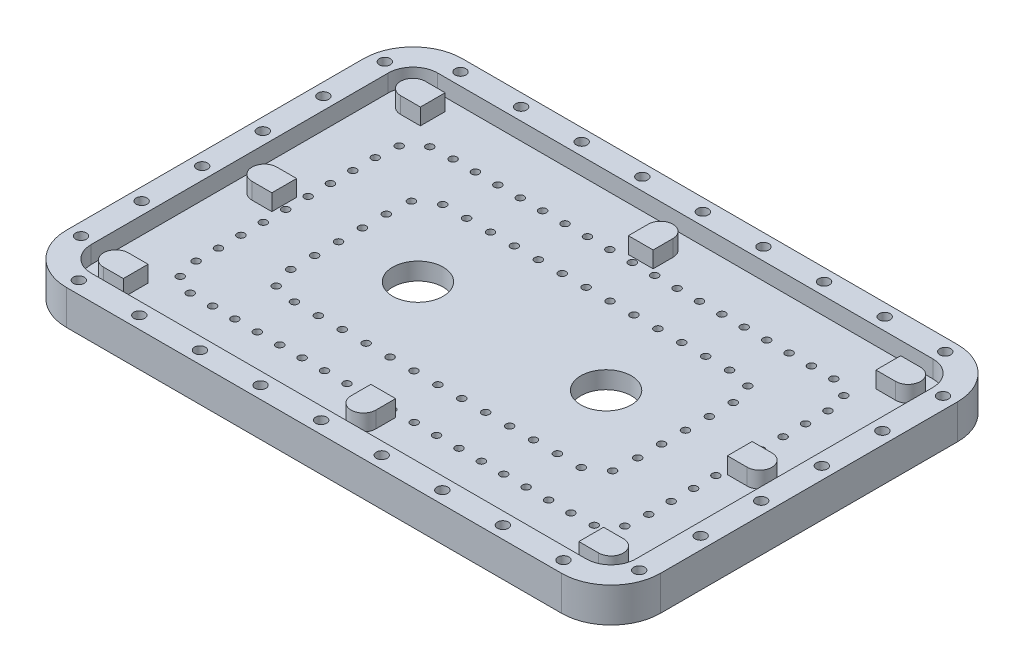
from build123d import *

# Parameters (mm, degrees)
SKETCH1_W                    = 120
SKETCH1_H                    = 80
BOSS_EXTRUDE1_DEPTH          = 7
SKETCH2_W                    = 110
SKETCH2_H                    = 70
CUT_EXTRUDE1_DEPTH           = 3.5
F_10_2_10_2_DIAMETER_HOLE1_D = 10.2
FILLET1_R                    = 10
FILLET3_R                    = 5
F_2_5MM_DOWEL_HOLE1_D        = 2.2
CRVPATTERN1_OUTLINE_R        = 1.1
CRVPATTERN1_DEPTH            = 7
F_1_5MM_DOWEL_HOLE2_D        = 1.5
CRVPATTERN3_OUTLINE_R        = 0.75
CRVPATTERN3_DEPTH            = 3.5
F_1_5MM_DOWEL_HOLE3_D        = 1.5
CRVPATTERN4_OUTLINE_R        = 0.75
CRVPATTERN4_DEPTH            = 3.5
BOSS_EXTRUDE2_DEPTH          = 3.3
SKETCH24_R                   = 2
CUT_EXTRUDE2_DEPTH           = 1.5
CRVPATTERN5_OUTLINE_R        = 2
CRVPATTERN5_OUTLINE_R_2      = 1.1
CRVPATTERN5_DEPTH            = 1.5


# Read off the part's stored shape, not the designer's step: CrvPattern1, CrvPattern3, CrvPattern4, CrvPattern5
with BuildPart() as part:
    # Sketch1 → Boss-Extrude1 (new body)
    with BuildSketch(Plane(origin=(0, 7, 0), x_dir=(1, 0, 0), z_dir=(0, 1, 0))):
        Rectangle(SKETCH1_W, SKETCH1_H)
    extrude(amount=-BOSS_EXTRUDE1_DEPTH)

    # Sketch2 → Cut-Extrude1 (cut)
    with BuildSketch(Plane(origin=(0, 7, 0), x_dir=(-1, 0, 0), z_dir=(0, 1, 0))):
        Rectangle(SKETCH2_W, SKETCH2_H)
    extrude(amount=-CUT_EXTRUDE1_DEPTH, mode=Mode.SUBTRACT)

    # Ø10.2 (10.2) Diameter Hole1 (through all)
    with Locations(Plane(origin=(0, 3.5, 0), x_dir=(1, 0, 0), z_dir=(0, 1, 0))):
        with Locations((19, 0), (-19, 0)):
            Hole(F_10_2_10_2_DIAMETER_HOLE1_D / 2)

    # Fillet1
    fillet1_edges = [part.edges().sort_by_distance(p)[0] for p in [
        (-60, 3.5, -40),
        (60, 3.5, -40),
        (60, 3.5, 40),
        (-60, 3.5, 40),
    ]]
    fillet(fillet1_edges, radius=FILLET1_R)

    # Fillet3
    fillet3_edges = [part.edges().sort_by_distance(p)[0] for p in [
        (-55, 5.25, 35),
        (-55, 5.25, -35),
        (55, 5.25, -35),
        (55, 5.25, 35),
    ]]
    fillet(fillet3_edges, radius=FILLET3_R)

    # Ø2.5mm Dowel Hole1 (through all)
    with Locations(Plane(origin=(0, 7, 0), x_dir=(1, 0, 0), z_dir=(0, 1, 0))):
        with Locations((50, 37.5)):
            Hole(F_2_5MM_DOWEL_HOLE1_D / 2)

    # CrvPattern1 outline → CrvPattern1 (cut)
    with BuildSketch(Plane(origin=(0, 0, 0), x_dir=(1, 0, 0), z_dir=(0, 1, 0))):
        with Locations((37.762537007, 37.5)):
            Circle(CRVPATTERN1_OUTLINE_R)
        with Locations((25.525074013, 37.5)):
            Circle(CRVPATTERN1_OUTLINE_R)
        with Locations((13.28761102, 37.5)):
            Circle(CRVPATTERN1_OUTLINE_R)
        with Locations((1.050148026, 37.5)):
            Circle(CRVPATTERN1_OUTLINE_R)
        with Locations((-11.187314967, 37.5)):
            Circle(CRVPATTERN1_OUTLINE_R)
        with Locations((-23.424777961, 37.5)):
            Circle(CRVPATTERN1_OUTLINE_R)
        with Locations((-35.662240954, 37.5)):
            Circle(CRVPATTERN1_OUTLINE_R)
        with Locations((-47.899703948, 37.5)):
            Circle(CRVPATTERN1_OUTLINE_R)
        with Locations((-57.320580195, 31.630676428)):
            Circle(CRVPATTERN1_OUTLINE_R)
        with Locations((-57.5, 19.406342516)):
            Circle(CRVPATTERN1_OUTLINE_R)
        with Locations((-57.5, 7.168879523)):
            Circle(CRVPATTERN1_OUTLINE_R)
        with Locations((-57.5, -5.068583471)):
            Circle(CRVPATTERN1_OUTLINE_R)
        with Locations((-57.5, -17.306046464)):
            Circle(CRVPATTERN1_OUTLINE_R)
        with Locations((-57.5, -29.543509458)):
            Circle(CRVPATTERN1_OUTLINE_R)
        with Locations((-50, -37.5)):
            Circle(CRVPATTERN1_OUTLINE_R)
        with Locations((-37.762537007, -37.5)):
            Circle(CRVPATTERN1_OUTLINE_R)
        with Locations((-25.525074013, -37.5)):
            Circle(CRVPATTERN1_OUTLINE_R)
        with Locations((-13.28761102, -37.5)):
            Circle(CRVPATTERN1_OUTLINE_R)
        with Locations((-1.050148026, -37.5)):
            Circle(CRVPATTERN1_OUTLINE_R)
        with Locations((11.187314967, -37.5)):
            Circle(CRVPATTERN1_OUTLINE_R)
        with Locations((23.424777961, -37.5)):
            Circle(CRVPATTERN1_OUTLINE_R)
        with Locations((35.662240954, -37.5)):
            Circle(CRVPATTERN1_OUTLINE_R)
        with Locations((47.899703948, -37.5)):
            Circle(CRVPATTERN1_OUTLINE_R)
        with Locations((57.320580195, -31.630676428)):
            Circle(CRVPATTERN1_OUTLINE_R)
        with Locations((57.5, -19.406342516)):
            Circle(CRVPATTERN1_OUTLINE_R)
        with Locations((57.5, -7.168879523)):
            Circle(CRVPATTERN1_OUTLINE_R)
        with Locations((57.5, 5.068583471)):
            Circle(CRVPATTERN1_OUTLINE_R)
        with Locations((57.5, 17.306046464)):
            Circle(CRVPATTERN1_OUTLINE_R)
        with Locations((57.5, 29.543509458)):
            Circle(CRVPATTERN1_OUTLINE_R)
    extrude(amount=CRVPATTERN1_DEPTH, mode=Mode.SUBTRACT)

    # Ø1.5mm Dowel Hole2 (through all)
    with Locations(Plane(origin=(0, 3.5, 0), x_dir=(1, 0, 0), z_dir=(0, 1, 0))):
        with Locations((40, 25)):
            Hole(F_1_5MM_DOWEL_HOLE2_D / 2)

    # CrvPattern3 outline → CrvPattern3 (cut)
    with BuildSketch(Plane(origin=(0, 0, 0), x_dir=(1, 0, 0), z_dir=(0, 1, 0))):
        with Locations((35.476401224, 25)):
            Circle(CRVPATTERN3_OUTLINE_R)
        with Locations((30.952802449, 25)):
            Circle(CRVPATTERN3_OUTLINE_R)
        with Locations((26.429203673, 25)):
            Circle(CRVPATTERN3_OUTLINE_R)
        with Locations((21.905604898, 25)):
            Circle(CRVPATTERN3_OUTLINE_R)
        with Locations((17.382006122, 25)):
            Circle(CRVPATTERN3_OUTLINE_R)
        with Locations((12.858407346, 25)):
            Circle(CRVPATTERN3_OUTLINE_R)
        with Locations((8.334808571, 25)):
            Circle(CRVPATTERN3_OUTLINE_R)
        with Locations((3.811209795, 25)):
            Circle(CRVPATTERN3_OUTLINE_R)
        with Locations((-0.71238898, 25)):
            Circle(CRVPATTERN3_OUTLINE_R)
        with Locations((-5.235987756, 25)):
            Circle(CRVPATTERN3_OUTLINE_R)
        with Locations((-9.759586532, 25)):
            Circle(CRVPATTERN3_OUTLINE_R)
        with Locations((-14.283185307, 25)):
            Circle(CRVPATTERN3_OUTLINE_R)
        with Locations((-18.806784083, 25)):
            Circle(CRVPATTERN3_OUTLINE_R)
        with Locations((-23.330382858, 25)):
            Circle(CRVPATTERN3_OUTLINE_R)
        with Locations((-27.853981634, 25)):
            Circle(CRVPATTERN3_OUTLINE_R)
        with Locations((-32.37758041, 25)):
            Circle(CRVPATTERN3_OUTLINE_R)
        with Locations((-36.901179185, 25)):
            Circle(CRVPATTERN3_OUTLINE_R)
        with Locations((-41.405574173, 24.798370687)):
            Circle(CRVPATTERN3_OUTLINE_R)
        with Locations((-44.64124129, 21.859806251)):
            Circle(CRVPATTERN3_OUTLINE_R)
        with Locations((-45, 17.382006122)):
            Circle(CRVPATTERN3_OUTLINE_R)
        with Locations((-45, 12.858407346)):
            Circle(CRVPATTERN3_OUTLINE_R)
        with Locations((-45, 8.334808571)):
            Circle(CRVPATTERN3_OUTLINE_R)
        with Locations((-45, 3.811209795)):
            Circle(CRVPATTERN3_OUTLINE_R)
        with Locations((-45, -0.71238898)):
            Circle(CRVPATTERN3_OUTLINE_R)
        with Locations((-45, -5.235987756)):
            Circle(CRVPATTERN3_OUTLINE_R)
        with Locations((-45, -9.759586532)):
            Circle(CRVPATTERN3_OUTLINE_R)
        with Locations((-45, -14.283185307)):
            Circle(CRVPATTERN3_OUTLINE_R)
        with Locations((-45, -18.806784083)):
            Circle(CRVPATTERN3_OUTLINE_R)
        with Locations((-43.931260104, -23.089529736)):
            Circle(CRVPATTERN3_OUTLINE_R)
        with Locations((-40, -25)):
            Circle(CRVPATTERN3_OUTLINE_R)
        with Locations((-35.476401224, -25)):
            Circle(CRVPATTERN3_OUTLINE_R)
        with Locations((-30.952802449, -25)):
            Circle(CRVPATTERN3_OUTLINE_R)
        with Locations((-26.429203673, -25)):
            Circle(CRVPATTERN3_OUTLINE_R)
        with Locations((-21.905604898, -25)):
            Circle(CRVPATTERN3_OUTLINE_R)
        with Locations((-17.382006122, -25)):
            Circle(CRVPATTERN3_OUTLINE_R)
        with Locations((-12.858407346, -25)):
            Circle(CRVPATTERN3_OUTLINE_R)
        with Locations((-8.334808571, -25)):
            Circle(CRVPATTERN3_OUTLINE_R)
        with Locations((-3.811209795, -25)):
            Circle(CRVPATTERN3_OUTLINE_R)
        with Locations((0.71238898, -25)):
            Circle(CRVPATTERN3_OUTLINE_R)
        with Locations((5.235987756, -25)):
            Circle(CRVPATTERN3_OUTLINE_R)
        with Locations((9.759586532, -25)):
            Circle(CRVPATTERN3_OUTLINE_R)
        with Locations((14.283185307, -25)):
            Circle(CRVPATTERN3_OUTLINE_R)
        with Locations((18.806784083, -25)):
            Circle(CRVPATTERN3_OUTLINE_R)
        with Locations((23.330382858, -25)):
            Circle(CRVPATTERN3_OUTLINE_R)
        with Locations((27.853981634, -25)):
            Circle(CRVPATTERN3_OUTLINE_R)
        with Locations((32.37758041, -25)):
            Circle(CRVPATTERN3_OUTLINE_R)
        with Locations((36.901179185, -25)):
            Circle(CRVPATTERN3_OUTLINE_R)
        with Locations((41.405574173, -24.798370687)):
            Circle(CRVPATTERN3_OUTLINE_R)
        with Locations((44.64124129, -21.859806251)):
            Circle(CRVPATTERN3_OUTLINE_R)
        with Locations((45, -17.382006122)):
            Circle(CRVPATTERN3_OUTLINE_R)
        with Locations((45, -12.858407346)):
            Circle(CRVPATTERN3_OUTLINE_R)
        with Locations((45, -8.334808571)):
            Circle(CRVPATTERN3_OUTLINE_R)
        with Locations((45, -3.811209795)):
            Circle(CRVPATTERN3_OUTLINE_R)
        with Locations((45, 0.71238898)):
            Circle(CRVPATTERN3_OUTLINE_R)
        with Locations((45, 5.235987756)):
            Circle(CRVPATTERN3_OUTLINE_R)
        with Locations((45, 9.759586532)):
            Circle(CRVPATTERN3_OUTLINE_R)
        with Locations((45, 14.283185307)):
            Circle(CRVPATTERN3_OUTLINE_R)
        with Locations((45, 18.806784083)):
            Circle(CRVPATTERN3_OUTLINE_R)
        with Locations((43.931260104, 23.089529736)):
            Circle(CRVPATTERN3_OUTLINE_R)
    extrude(amount=CRVPATTERN3_DEPTH, mode=Mode.SUBTRACT)

    # Ø1.5mm Dowel Hole3 (through all)
    with Locations(Plane(origin=(0, 0, 0), x_dir=(-1, 0, 0), z_dir=(0, -1, 0))):
        with Locations((-30, -16)):
            Hole(F_1_5MM_DOWEL_HOLE3_D / 2)

    # CrvPattern4 outline → CrvPattern4 (cut)
    with BuildSketch(Plane(origin=(0, 0, 0), x_dir=(1, 0, 0), z_dir=(0, 1, 0))):
        with Locations((25.171681469, -16)):
            Circle(CRVPATTERN4_OUTLINE_R)
        with Locations((20.343362939, -16)):
            Circle(CRVPATTERN4_OUTLINE_R)
        with Locations((15.515044408, -16)):
            Circle(CRVPATTERN4_OUTLINE_R)
        with Locations((10.686725877, -16)):
            Circle(CRVPATTERN4_OUTLINE_R)
        with Locations((5.858407346, -16)):
            Circle(CRVPATTERN4_OUTLINE_R)
        with Locations((1.030088816, -16)):
            Circle(CRVPATTERN4_OUTLINE_R)
        with Locations((-3.798229715, -16)):
            Circle(CRVPATTERN4_OUTLINE_R)
        with Locations((-8.626548246, -16)):
            Circle(CRVPATTERN4_OUTLINE_R)
        with Locations((-13.454866776, -16)):
            Circle(CRVPATTERN4_OUTLINE_R)
        with Locations((-18.283185307, -16)):
            Circle(CRVPATTERN4_OUTLINE_R)
        with Locations((-23.111503838, -16)):
            Circle(CRVPATTERN4_OUTLINE_R)
        with Locations((-27.939822369, -16)):
            Circle(CRVPATTERN4_OUTLINE_R)
        with Locations((-32.552422087, -15.079795689)):
            Circle(CRVPATTERN4_OUTLINE_R)
        with Locations((-34, -10.686725877)):
            Circle(CRVPATTERN4_OUTLINE_R)
        with Locations((-34, -5.858407346)):
            Circle(CRVPATTERN4_OUTLINE_R)
        with Locations((-34, -1.030088816)):
            Circle(CRVPATTERN4_OUTLINE_R)
        with Locations((-34, 3.798229715)):
            Circle(CRVPATTERN4_OUTLINE_R)
        with Locations((-34, 8.626548246)):
            Circle(CRVPATTERN4_OUTLINE_R)
        with Locations((-33.738324268, 13.423000937)):
            Circle(CRVPATTERN4_OUTLINE_R)
        with Locations((-30, 16)):
            Circle(CRVPATTERN4_OUTLINE_R)
        with Locations((-25.171681469, 16)):
            Circle(CRVPATTERN4_OUTLINE_R)
        with Locations((-20.343362939, 16)):
            Circle(CRVPATTERN4_OUTLINE_R)
        with Locations((-15.515044408, 16)):
            Circle(CRVPATTERN4_OUTLINE_R)
        with Locations((-10.686725877, 16)):
            Circle(CRVPATTERN4_OUTLINE_R)
        with Locations((-5.858407346, 16)):
            Circle(CRVPATTERN4_OUTLINE_R)
        with Locations((-1.030088816, 16)):
            Circle(CRVPATTERN4_OUTLINE_R)
        with Locations((3.798229715, 16)):
            Circle(CRVPATTERN4_OUTLINE_R)
        with Locations((8.626548246, 16)):
            Circle(CRVPATTERN4_OUTLINE_R)
        with Locations((13.454866776, 16)):
            Circle(CRVPATTERN4_OUTLINE_R)
        with Locations((18.283185307, 16)):
            Circle(CRVPATTERN4_OUTLINE_R)
        with Locations((23.111503838, 16)):
            Circle(CRVPATTERN4_OUTLINE_R)
        with Locations((27.939822369, 16)):
            Circle(CRVPATTERN4_OUTLINE_R)
        with Locations((32.552422087, 15.079795689)):
            Circle(CRVPATTERN4_OUTLINE_R)
        with Locations((34, 10.686725877)):
            Circle(CRVPATTERN4_OUTLINE_R)
        with Locations((34, 5.858407346)):
            Circle(CRVPATTERN4_OUTLINE_R)
        with Locations((34, 1.030088816)):
            Circle(CRVPATTERN4_OUTLINE_R)
        with Locations((34, -3.798229715)):
            Circle(CRVPATTERN4_OUTLINE_R)
        with Locations((34, -8.626548246)):
            Circle(CRVPATTERN4_OUTLINE_R)
        with Locations((33.738324268, -13.423000937)):
            Circle(CRVPATTERN4_OUTLINE_R)
    extrude(amount=CRVPATTERN4_DEPTH, mode=Mode.SUBTRACT)

    # Sketch23 → Boss-Extrude2 (add)
    with BuildSketch(Plane(origin=(0, 3.5, 0), x_dir=(1, 0, 0), z_dir=(0, 1, 0))):
        with BuildLine():
            ThreePointArc((52.5, -30), (51.767766953, -28.232233047), (50, -27.5))
            Line((50, -27.5), (50, -32.5))
            ThreePointArc((50, -32.5), (51.767766953, -31.767766953), (52.5, -30))
        make_face()
        with BuildLine():
            Line((50, -32.5), (50, -27.5))
            ThreePointArc((50, -27.5), (47.5, -30), (50, -32.5))
        make_face()
        with BuildLine():
            ThreePointArc((50, -32.5), (47.5, -30), (50, -27.5))
            Line((50, -27.5), (46, -27.5))
            Line((46, -27.5), (46, -32.5))
            Line((46, -32.5), (50, -32.5))
        make_face()
        with BuildLine():
            Line((46, -2.5), (50, -2.5))
            ThreePointArc((50, -2.5), (47.5, 0), (50, 2.5))
            Line((50, 2.5), (46, 2.5))
            Line((46, 2.5), (46, -2.5))
        make_face()
        with BuildLine():
            ThreePointArc((50, 2.5), (47.5, 0), (50, -2.5))
            Line((50, -2.5), (50, 2.5))
        make_face()
        with BuildLine():
            Line((50, 2.5), (50, -2.5))
            ThreePointArc((50, -2.5), (51.767766953, -1.767766953), (52.5, 0))
            ThreePointArc((52.5, 0), (51.767766953, 1.767766953), (50, 2.5))
        make_face()
        with BuildLine():
            Line((46, 27.5), (50, 27.5))
            ThreePointArc((50, 27.5), (47.5, 30), (50, 32.5))
            Line((50, 32.5), (46, 32.5))
            Line((46, 32.5), (46, 27.5))
        make_face()
        with BuildLine():
            ThreePointArc((50, 32.5), (47.5, 30), (50, 27.5))
            Line((50, 27.5), (50, 32.5))
        make_face()
        with BuildLine():
            Line((50, 32.5), (50, 27.5))
            ThreePointArc((50, 27.5), (51.767766953, 28.232233047), (52.5, 30))
            ThreePointArc((52.5, 30), (51.767766953, 31.767766953), (50, 32.5))
        make_face()
        with BuildLine():
            ThreePointArc((2.5, 30), (0, 27.5), (-2.5, 30))
            Line((-2.5, 30), (-2.5, 26))
            Line((-2.5, 26), (2.5, 26))
            Line((2.5, 26), (2.5, 30))
        make_face()
        with BuildLine():
            ThreePointArc((2.5, 30), (0, 32.5), (-2.5, 30))
            Line((-2.5, 30), (2.5, 30))
        make_face()
        with BuildLine():
            Line((2.5, 30), (-2.5, 30))
            ThreePointArc((-2.5, 30), (0, 27.5), (2.5, 30))
        make_face()
        with BuildLine():
            ThreePointArc((-2.5, -30), (0, -27.5), (2.5, -30))
            Line((2.5, -30), (2.5, -26))
            Line((2.5, -26), (-2.5, -26))
            Line((-2.5, -26), (-2.5, -30))
        make_face()
        with BuildLine():
            ThreePointArc((-2.5, -30), (0, -32.5), (2.5, -30))
            Line((2.5, -30), (-2.5, -30))
        make_face()
        with BuildLine():
            Line((-2.5, -30), (2.5, -30))
            ThreePointArc((2.5, -30), (0, -27.5), (-2.5, -30))
        make_face()
        with BuildLine():
            ThreePointArc((-50, -27.5), (-52.5, -30), (-50, -32.5))
            Line((-50, -32.5), (-50, -27.5))
        make_face()
        with BuildLine():
            Line((-50, -27.5), (-50, -32.5))
            ThreePointArc((-50, -32.5), (-48.232233047, -31.767766953), (-47.5, -30))
            ThreePointArc((-47.5, -30), (-48.232233047, -28.232233047), (-50, -27.5))
        make_face()
        with BuildLine():
            ThreePointArc((-47.5, -30), (-48.232233047, -31.767766953), (-50, -32.5))
            Line((-50, -32.5), (-46, -32.5))
            Line((-46, -32.5), (-46, -27.5))
            Line((-46, -27.5), (-50, -27.5))
            ThreePointArc((-50, -27.5), (-48.232233047, -28.232233047), (-47.5, -30))
        make_face()
        with BuildLine():
            ThreePointArc((-50, 32.5), (-52.5, 30), (-50, 27.5))
            Line((-50, 27.5), (-50, 32.5))
        make_face()
        with BuildLine():
            Line((-50, 32.5), (-50, 27.5))
            ThreePointArc((-50, 27.5), (-48.232233047, 28.232233047), (-47.5, 30))
            ThreePointArc((-47.5, 30), (-48.232233047, 31.767766953), (-50, 32.5))
        make_face()
        with BuildLine():
            ThreePointArc((-47.5, 30), (-48.232233047, 28.232233047), (-50, 27.5))
            Line((-50, 27.5), (-46, 27.5))
            Line((-46, 27.5), (-46, 32.5))
            Line((-46, 32.5), (-50, 32.5))
            ThreePointArc((-50, 32.5), (-48.232233047, 31.767766953), (-47.5, 30))
        make_face()
        with BuildLine():
            ThreePointArc((-50, 2.5), (-52.5, 0), (-50, -2.5))
            Line((-50, -2.5), (-50, 2.5))
        make_face()
        with BuildLine():
            Line((-50, 2.5), (-50, -2.5))
            ThreePointArc((-50, -2.5), (-48.232233047, -1.767766953), (-47.5, 0))
            ThreePointArc((-47.5, 0), (-48.232233047, 1.767766953), (-50, 2.5))
        make_face()
        with BuildLine():
            ThreePointArc((-47.5, 0), (-48.232233047, -1.767766953), (-50, -2.5))
            Line((-50, -2.5), (-46, -2.5))
            Line((-46, -2.5), (-46, 2.5))
            Line((-46, 2.5), (-50, 2.5))
            ThreePointArc((-50, 2.5), (-48.232233047, 1.767766953), (-47.5, 0))
        make_face()
    extrude(amount=BOSS_EXTRUDE2_DEPTH)

    # Sketch24 → Cut-Extrude2 (cut)
    with BuildSketch(Plane.XZ):
        with Locations(Location((57.5, 19.406342516, 0), (0, 0, 270))):
            Circle(SKETCH24_R)
    extrude(amount=-CUT_EXTRUDE2_DEPTH, mode=Mode.SUBTRACT)

    # CrvPattern5 outline → CrvPattern5 (cut)
    # profile 1 of 29: a face of its own
    with BuildSketch(Plane(origin=(0, 0, 0), x_dir=(1, 0, 0), z_dir=(0, 1, 0))):
        with Locations((57.5, 29.543509458)):
            Circle(CRVPATTERN5_OUTLINE_R)
        with Locations((57.5, 29.543509458)):
            Circle(CRVPATTERN5_OUTLINE_R_2, mode=Mode.SUBTRACT)
    # profile 2 of 29: a face of its own
    with BuildSketch(Plane(origin=(0, 0, 0), x_dir=(1, 0, 0), z_dir=(0, 1, 0))):
        with Locations((57.5, 17.306046464)):
            Circle(CRVPATTERN5_OUTLINE_R)
        with Locations((57.5, 17.306046464)):
            Circle(CRVPATTERN5_OUTLINE_R_2, mode=Mode.SUBTRACT)
    # profile 3 of 29: a face of its own
    with BuildSketch(Plane(origin=(0, 0, 0), x_dir=(1, 0, 0), z_dir=(0, 1, 0))):
        with Locations((57.5, 5.068583471)):
            Circle(CRVPATTERN5_OUTLINE_R)
        with Locations((57.5, 5.068583471)):
            Circle(CRVPATTERN5_OUTLINE_R_2, mode=Mode.SUBTRACT)
    # profile 4 of 29: a face of its own
    with BuildSketch(Plane(origin=(0, 0, 0), x_dir=(1, 0, 0), z_dir=(0, 1, 0))):
        with Locations((57.5, -7.168879523)):
            Circle(CRVPATTERN5_OUTLINE_R)
        with Locations((57.5, -7.168879523)):
            Circle(CRVPATTERN5_OUTLINE_R_2, mode=Mode.SUBTRACT)
    # profile 5 of 29: a face of its own
    with BuildSketch(Plane(origin=(0, 0, 0), x_dir=(1, 0, 0), z_dir=(0, 1, 0))):
        with Locations((57.320580195, -31.630676428)):
            Circle(CRVPATTERN5_OUTLINE_R)
        with Locations((57.320580195, -31.630676428)):
            Circle(CRVPATTERN5_OUTLINE_R_2, mode=Mode.SUBTRACT)
    # profile 6 of 29: a face of its own
    with BuildSketch(Plane(origin=(0, 0, 0), x_dir=(1, 0, 0), z_dir=(0, 1, 0))):
        with Locations((47.899703948, -37.5)):
            Circle(CRVPATTERN5_OUTLINE_R)
        with Locations((47.899703948, -37.5)):
            Circle(CRVPATTERN5_OUTLINE_R_2, mode=Mode.SUBTRACT)
    # profile 7 of 29: a face of its own
    with BuildSketch(Plane(origin=(0, 0, 0), x_dir=(1, 0, 0), z_dir=(0, 1, 0))):
        with Locations((35.662240954, -37.5)):
            Circle(CRVPATTERN5_OUTLINE_R)
        with Locations((35.662240954, -37.5)):
            Circle(CRVPATTERN5_OUTLINE_R_2, mode=Mode.SUBTRACT)
    # profile 8 of 29: a face of its own
    with BuildSketch(Plane(origin=(0, 0, 0), x_dir=(1, 0, 0), z_dir=(0, 1, 0))):
        with Locations((23.424777961, -37.5)):
            Circle(CRVPATTERN5_OUTLINE_R)
        with Locations((23.424777961, -37.5)):
            Circle(CRVPATTERN5_OUTLINE_R_2, mode=Mode.SUBTRACT)
    # profile 9 of 29: a face of its own
    with BuildSketch(Plane(origin=(0, 0, 0), x_dir=(1, 0, 0), z_dir=(0, 1, 0))):
        with Locations((11.187314967, -37.5)):
            Circle(CRVPATTERN5_OUTLINE_R)
        with Locations((11.187314967, -37.5)):
            Circle(CRVPATTERN5_OUTLINE_R_2, mode=Mode.SUBTRACT)
    # profile 10 of 29: a face of its own
    with BuildSketch(Plane(origin=(0, 0, 0), x_dir=(1, 0, 0), z_dir=(0, 1, 0))):
        with Locations((-1.050148026, -37.5)):
            Circle(CRVPATTERN5_OUTLINE_R)
        with Locations((-1.050148026, -37.5)):
            Circle(CRVPATTERN5_OUTLINE_R_2, mode=Mode.SUBTRACT)
    # profile 11 of 29: a face of its own
    with BuildSketch(Plane(origin=(0, 0, 0), x_dir=(1, 0, 0), z_dir=(0, 1, 0))):
        with Locations((-13.28761102, -37.5)):
            Circle(CRVPATTERN5_OUTLINE_R)
        with Locations((-13.28761102, -37.5)):
            Circle(CRVPATTERN5_OUTLINE_R_2, mode=Mode.SUBTRACT)
    # profile 12 of 29: a face of its own
    with BuildSketch(Plane(origin=(0, 0, 0), x_dir=(1, 0, 0), z_dir=(0, 1, 0))):
        with Locations((-25.525074013, -37.5)):
            Circle(CRVPATTERN5_OUTLINE_R)
        with Locations((-25.525074013, -37.5)):
            Circle(CRVPATTERN5_OUTLINE_R_2, mode=Mode.SUBTRACT)
    # profile 13 of 29: a face of its own
    with BuildSketch(Plane(origin=(0, 0, 0), x_dir=(1, 0, 0), z_dir=(0, 1, 0))):
        with Locations((-37.762537007, -37.5)):
            Circle(CRVPATTERN5_OUTLINE_R)
        with Locations((-37.762537007, -37.5)):
            Circle(CRVPATTERN5_OUTLINE_R_2, mode=Mode.SUBTRACT)
    # profile 14 of 29: a face of its own
    with BuildSketch(Plane(origin=(0, 0, 0), x_dir=(1, 0, 0), z_dir=(0, 1, 0))):
        with Locations((-50, -37.5)):
            Circle(CRVPATTERN5_OUTLINE_R)
        with Locations((-50, -37.5)):
            Circle(CRVPATTERN5_OUTLINE_R_2, mode=Mode.SUBTRACT)
    # profile 15 of 29: a face of its own
    with BuildSketch(Plane(origin=(0, 0, 0), x_dir=(1, 0, 0), z_dir=(0, 1, 0))):
        with Locations((-57.5, -29.543509458)):
            Circle(CRVPATTERN5_OUTLINE_R)
        with Locations((-57.5, -29.543509458)):
            Circle(CRVPATTERN5_OUTLINE_R_2, mode=Mode.SUBTRACT)
    # profile 16 of 29: a face of its own
    with BuildSketch(Plane(origin=(0, 0, 0), x_dir=(1, 0, 0), z_dir=(0, 1, 0))):
        with Locations((-57.5, -17.306046464)):
            Circle(CRVPATTERN5_OUTLINE_R)
        with Locations((-57.5, -17.306046464)):
            Circle(CRVPATTERN5_OUTLINE_R_2, mode=Mode.SUBTRACT)
    # profile 17 of 29: a face of its own
    with BuildSketch(Plane(origin=(0, 0, 0), x_dir=(1, 0, 0), z_dir=(0, 1, 0))):
        with Locations((-57.5, -5.068583471)):
            Circle(CRVPATTERN5_OUTLINE_R)
        with Locations((-57.5, -5.068583471)):
            Circle(CRVPATTERN5_OUTLINE_R_2, mode=Mode.SUBTRACT)
    # profile 18 of 29: a face of its own
    with BuildSketch(Plane(origin=(0, 0, 0), x_dir=(1, 0, 0), z_dir=(0, 1, 0))):
        with Locations((-57.5, 7.168879523)):
            Circle(CRVPATTERN5_OUTLINE_R)
        with Locations((-57.5, 7.168879523)):
            Circle(CRVPATTERN5_OUTLINE_R_2, mode=Mode.SUBTRACT)
    # profile 19 of 29: a face of its own
    with BuildSketch(Plane(origin=(0, 0, 0), x_dir=(1, 0, 0), z_dir=(0, 1, 0))):
        with Locations((-57.5, 19.406342516)):
            Circle(CRVPATTERN5_OUTLINE_R)
        with Locations((-57.5, 19.406342516)):
            Circle(CRVPATTERN5_OUTLINE_R_2, mode=Mode.SUBTRACT)
    # profile 20 of 29: a face of its own
    with BuildSketch(Plane(origin=(0, 0, 0), x_dir=(1, 0, 0), z_dir=(0, 1, 0))):
        with Locations((-57.320580195, 31.630676428)):
            Circle(CRVPATTERN5_OUTLINE_R)
        with Locations((-57.320580195, 31.630676428)):
            Circle(CRVPATTERN5_OUTLINE_R_2, mode=Mode.SUBTRACT)
    # profile 21 of 29: a face of its own
    with BuildSketch(Plane(origin=(0, 0, 0), x_dir=(1, 0, 0), z_dir=(0, 1, 0))):
        with Locations((-47.899703948, 37.5)):
            Circle(CRVPATTERN5_OUTLINE_R)
        with Locations((-47.899703948, 37.5)):
            Circle(CRVPATTERN5_OUTLINE_R_2, mode=Mode.SUBTRACT)
    # profile 22 of 29: a face of its own
    with BuildSketch(Plane(origin=(0, 0, 0), x_dir=(1, 0, 0), z_dir=(0, 1, 0))):
        with Locations((-35.662240954, 37.5)):
            Circle(CRVPATTERN5_OUTLINE_R)
        with Locations((-35.662240954, 37.5)):
            Circle(CRVPATTERN5_OUTLINE_R_2, mode=Mode.SUBTRACT)
    # profile 23 of 29: a face of its own
    with BuildSketch(Plane(origin=(0, 0, 0), x_dir=(1, 0, 0), z_dir=(0, 1, 0))):
        with Locations((-23.424777961, 37.5)):
            Circle(CRVPATTERN5_OUTLINE_R)
        with Locations((-23.424777961, 37.5)):
            Circle(CRVPATTERN5_OUTLINE_R_2, mode=Mode.SUBTRACT)
    # profile 24 of 29: a face of its own
    with BuildSketch(Plane(origin=(0, 0, 0), x_dir=(1, 0, 0), z_dir=(0, 1, 0))):
        with Locations((-11.187314967, 37.5)):
            Circle(CRVPATTERN5_OUTLINE_R)
        with Locations((-11.187314967, 37.5)):
            Circle(CRVPATTERN5_OUTLINE_R_2, mode=Mode.SUBTRACT)
    # profile 25 of 29: a face of its own
    with BuildSketch(Plane(origin=(0, 0, 0), x_dir=(1, 0, 0), z_dir=(0, 1, 0))):
        with Locations((1.050148026, 37.5)):
            Circle(CRVPATTERN5_OUTLINE_R)
        with Locations((1.050148026, 37.5)):
            Circle(CRVPATTERN5_OUTLINE_R_2, mode=Mode.SUBTRACT)
    # profile 26 of 29: a face of its own
    with BuildSketch(Plane(origin=(0, 0, 0), x_dir=(1, 0, 0), z_dir=(0, 1, 0))):
        with Locations((13.28761102, 37.5)):
            Circle(CRVPATTERN5_OUTLINE_R)
        with Locations((13.28761102, 37.5)):
            Circle(CRVPATTERN5_OUTLINE_R_2, mode=Mode.SUBTRACT)
    # profile 27 of 29: a face of its own
    with BuildSketch(Plane(origin=(0, 0, 0), x_dir=(1, 0, 0), z_dir=(0, 1, 0))):
        with Locations((25.525074013, 37.5)):
            Circle(CRVPATTERN5_OUTLINE_R)
        with Locations((25.525074013, 37.5)):
            Circle(CRVPATTERN5_OUTLINE_R_2, mode=Mode.SUBTRACT)
    # profile 28 of 29: a face of its own
    with BuildSketch(Plane(origin=(0, 0, 0), x_dir=(1, 0, 0), z_dir=(0, 1, 0))):
        with Locations((37.762537007, 37.5)):
            Circle(CRVPATTERN5_OUTLINE_R)
        with Locations((37.762537007, 37.5)):
            Circle(CRVPATTERN5_OUTLINE_R_2, mode=Mode.SUBTRACT)
    # profile 29 of 29: a face of its own
    with BuildSketch(Plane(origin=(0, 0, 0), x_dir=(1, 0, 0), z_dir=(0, 1, 0))):
        with Locations((50, 37.5)):
            Circle(CRVPATTERN5_OUTLINE_R)
        with Locations((50, 37.5)):
            Circle(CRVPATTERN5_OUTLINE_R_2, mode=Mode.SUBTRACT)
    extrude(amount=CRVPATTERN5_DEPTH, mode=Mode.SUBTRACT)


solid = part.part
